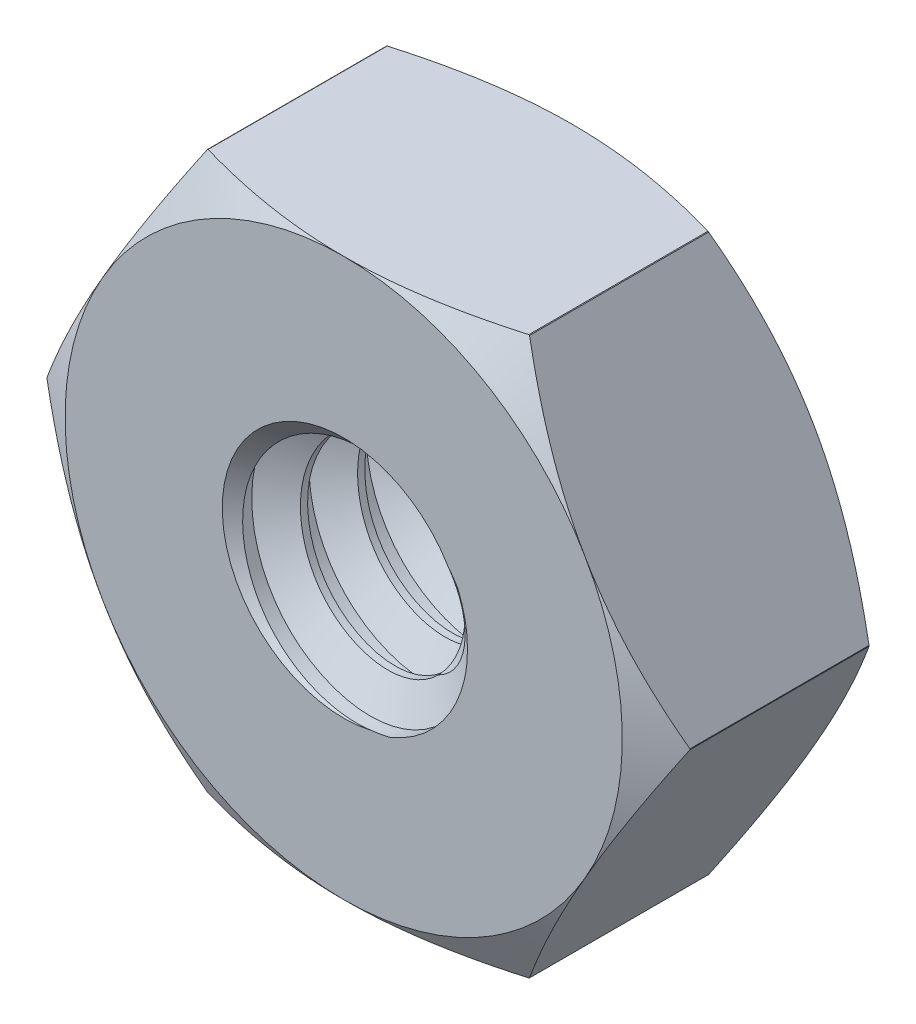
from build123d import *

# Parameters (mm, degrees)
THREAD1_PITCH      = 0.4
SKETCH2_OUTSIDE_W  = 7.812
SKETCH2_OUTSIDE_H  = 7.812
CUT_EXTRUDE1_DEPTH = 6.279441289


with BuildPart() as part:
    # Sketch1 → Revolve2 (revolve)
    with BuildSketch(Plane(origin=(0, 0, 0), x_dir=(1, 0, 0), z_dir=(0, 1, 0))):
        Polygon((0.3, 0), (1.4, 0), (1.6, 0.2), (1.6, 1.4), (1.4, 1.6), (0.3, 1.6), (0, 1.426794919), (0, 0.173205081), align=None)
    revolve(axis=Axis((2.25, 0, -2.136793789), (0, 0, 1)))

    # Thread1: arcs per turn and ends read off the stored shape
    # Thread1: the profile of Thread Profile2 profile screwed along a right-hand helix through 8 turns, 6 arcs to a turn; built about Z, then put on its axis
    thread1_z = Axis((0, 0, 0), (0, 0, 1))
    thread1_corners = [(0.6497, 0, -0.000173205), (0.6497, 0, 0.350173204), (0.86650635, 0, 0.224999999), (0.86650635, 0, 0.124999999)]
    with BuildLine(mode=Mode.PRIVATE) as thread1_profile:
        Line(thread1_corners[0], thread1_corners[1])
        Line(thread1_corners[1], thread1_corners[2])
        Line(thread1_corners[2], thread1_corners[3])
        Line(thread1_corners[3], thread1_corners[0])
    thread1_cap = Face(thread1_profile.wire())
    thread1_turn_angles = [0, 30, 60, 90, 120, 150, 180, 210, 240, 270, 300, 330, 360]
    thread1_turn_weights = [1, 0.8660254037844387, 1, 0.8660254037844387, 1, 0.8660254037844387, 1, 0.8660254037844387, 1, 0.8660254037844387, 1, 0.8660254037844387, 1]
    thread1_turn_rails = [Edge.make_bspline([Vector(p[0], p[1], 0).rotate(thread1_z, thread1_turn_angles[k]) / thread1_turn_weights[k] + Vector(0, 0, p[2] + THREAD1_PITCH * thread1_turn_angles[k] / 360) for k in range(13)], [0, 0, 0, 1, 1, 2, 2, 3, 3, 4, 4, 5, 5, 6, 6, 6], 2, thread1_turn_weights) for p in thread1_corners]
    thread1_turn_sides = [Face.make_surface_from_curves(thread1_turn_rails[p[0]], thread1_turn_rails[p[1]]) for p in [(0, 1), (1, 2), (2, 3), (3, 0)]]
    thread1 = Plane(origin=(2.25, 0, 0.8), x_dir=(-1, 0, 0), z_dir=(0, 0, -1)) * Solid(Shell([*[p.moved(Location((0, 0, THREAD1_PITCH * i))) for i in range(8) for p in thread1_turn_sides], thread1_cap, thread1_cap.rotate(thread1_z, 2880).moved(Location((0, 0, THREAD1_PITCH * 2880 / 360)))]))
    add(thread1, mode=Mode.SUBTRACT)

    # Sketch2 outside → Cut-Extrude1 (cut, through all)
    with BuildSketch(Plane.XY):
        with Locations((2.25, 0)):
            Rectangle(SKETCH2_OUTSIDE_W, SKETCH2_OUTSIDE_H)
        Polygon((3.375833025, -1.95), (4.50166605, 0), (3.375833025, 1.95), (1.124166975, 1.95), (-0.00166605, 0), (1.124166975, -1.95), align=None, mode=Mode.SUBTRACT)
    extrude(amount=-CUT_EXTRUDE1_DEPTH, mode=Mode.SUBTRACT)


solid = part.part
